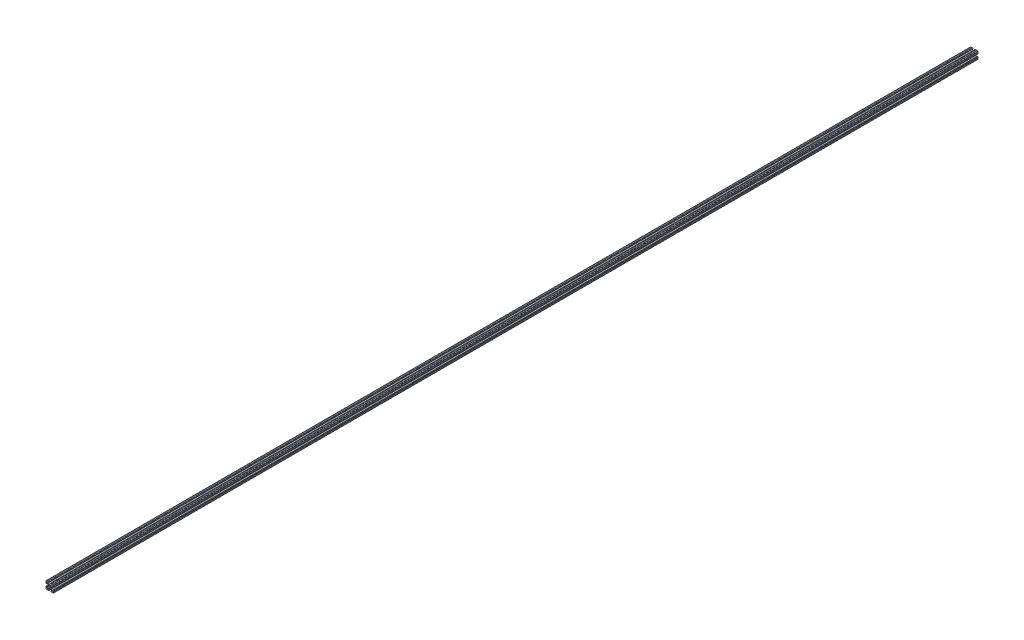
from build123d import *

# Parameters (mm, degrees)
BOSS_EXTRUDE1_DEPTH     = 1524
CUT_EXTRUDE1_DEPTH      = 1525.105829659
CUT_EXTRUDE1_DEPTH_BACK = 1525.105829659
SKETCH5_R               = 0.55245


with BuildPart() as part:
    # Sketch4 → Boss-Extrude1 (new, symmetric)
    with BuildSketch(Plane.XY):
        with BuildLine():
            Line((4.190365, -12.7), (10.11729625, -12.7))
            ThreePointArc((10.11729625, -12.7), (11.943543585, -11.943543585), (12.7, -10.11729625))
            Line((12.7, -10.11729625), (12.7, -4.190365))
            ThreePointArc((12.7, -4.190365), (12.42492494, -3.52627506), (11.760835, -3.2512))
            Line((11.760835, -3.2512), (11.429365, -3.2512))
            ThreePointArc((11.429365, -3.2512), (10.76527506, -3.52627506), (10.4902, -4.190365))
            Line((10.4902, -4.190365), (10.4902, -6.348478019))
            ThreePointArc((10.4902, -6.348478019), (9.830707141, -7.335478831), (8.666460301, -7.103895736))
            Line((8.666460301, -7.103895736), (5.299899128, -3.737334563))
            ThreePointArc((5.299899128, -3.737334563), (4.817571085, -3.015479634), (4.6482, -2.16399369))
            Line((4.6482, -2.16399369), (4.6482, 0))
            Line((4.6482, 0), (2.6035, 0))
            ThreePointArc((2.6035, 0), (1.840952505, -1.840952505), (0, -2.6035))
            Line((0, -2.6035), (0, -4.6482))
            Line((0, -4.6482), (2.16399369, -4.6482))
            ThreePointArc((2.16399369, -4.6482), (3.015479634, -4.817571085), (3.737334563, -5.299899128))
            Line((3.737334563, -5.299899128), (7.103895736, -8.666460301))
            ThreePointArc((7.103895736, -8.666460301), (7.335478831, -9.830707141), (6.348478019, -10.4902))
            Line((6.348478019, -10.4902), (4.190365, -10.4902))
            ThreePointArc((4.190365, -10.4902), (3.52627506, -10.76527506), (3.2512, -11.429365))
            Line((3.2512, -11.429365), (3.2512, -11.760835))
            ThreePointArc((3.2512, -11.760835), (3.52627506, -12.42492494), (4.190365, -12.7))
        make_face()
    extrude(amount=BOSS_EXTRUDE1_DEPTH, both=True)

    # Sketch5 → Cut-Extrude1 (cut, two sides: drawn at the far end of the back side and taken through both)
    with BuildSketch(Plane.XY.offset(-CUT_EXTRUDE1_DEPTH_BACK)):
        with Locations((10.356153152, -12.7)):
            Circle(SKETCH5_R)
        with Locations((5.796028019, -12.7)):
            Circle(SKETCH5_R)
        with Locations((12.7, -10.356153152)):
            Circle(SKETCH5_R)
        with Locations((12.7, -5.796028019)):
            Circle(SKETCH5_R)
    extrude(amount=CUT_EXTRUDE1_DEPTH + CUT_EXTRUDE1_DEPTH_BACK, mode=Mode.SUBTRACT)

    # Mirror1: part across plane


with BuildPart() as part_1:
    add(part.part)
    add(part.part.mirror(Plane(origin=(0, 0, 0), x_dir=(0, 0, 1), z_dir=(1, 0, 0))))

    # Mirror2: part across plane


with BuildPart() as part_2:
    add(part_1.part)
    add(part_1.part.mirror(Plane.ZX))


solid = part_2.part
